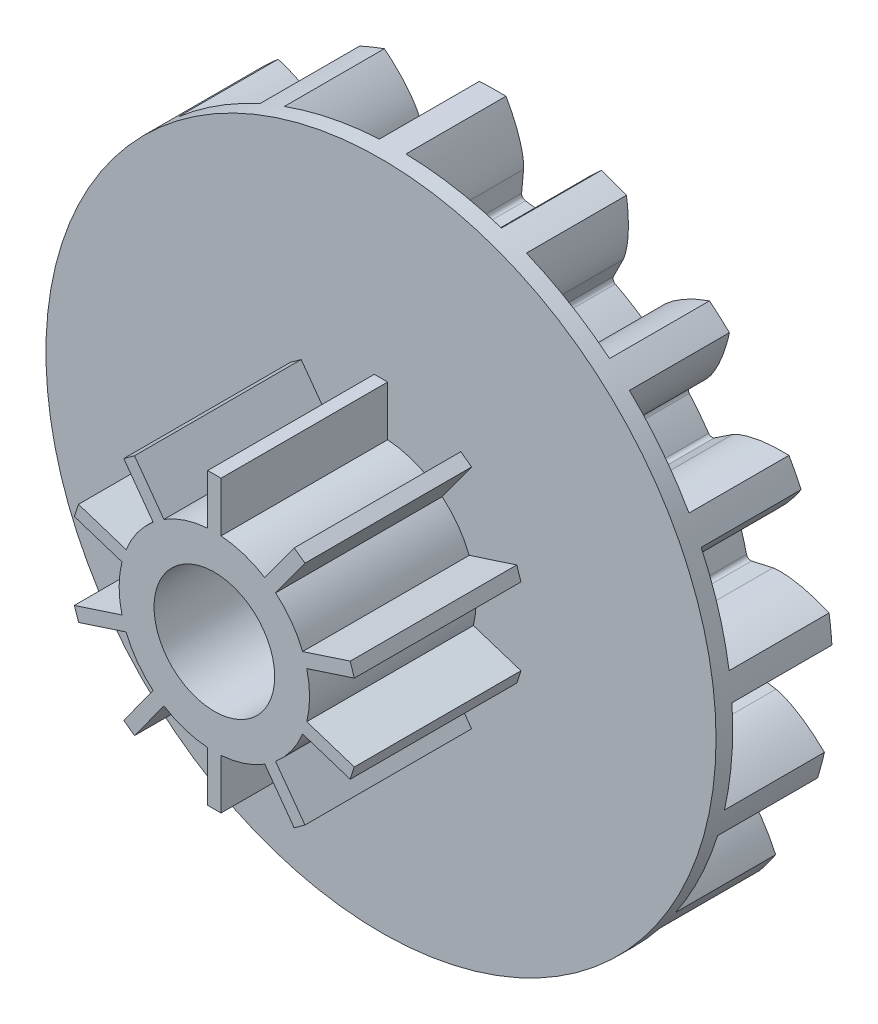
from build123d import *

# Parameters (mm, degrees)
SKETCH2_R                = 20.108333333
BOSS_EXTRUDE1_DEPTH      = 6
CUT_EXTRUDE1_DEPTH       = 6
FILLET1_R                = 0.254
CIRPATTERN3_COUNT        = 17
FILLET1_OF_CIRPATTERN3_R = 0.254
SKETCH3_R                = 20.108333333
BOSS_EXTRUDE2_DEPTH      = 1
SKETCH4_R                = 5.715
BOSS_EXTRUDE3_DEPTH      = 10
SKETCH5_R                = 3.6195
CUT_EXTRUDE2_DEPTH       = 34.13140731


# Read off the part's stored shape, not the designer's step: Cut-Extrude1
with BuildPart() as part:
    # Sketch2 → Boss-Extrude1 (new body)
    with BuildSketch(Plane.XY):
        Circle(SKETCH2_R)
    extrude(amount=BOSS_EXTRUDE1_DEPTH)

    # Cut-Extrude1 outline → Cut-Extrude1 (cut)
    with BuildSketch(Plane.XY):
        with BuildLine():
            add(Edge.make_bspline(
                [(19.612102582, -4.439651085), (19.59218272, -4.420144694), (19.481027528, -4.312057491), (19.281823842, -4.125802304), (19.027647422, -3.903870405), (18.736653642, -3.6720205), (18.488102998, -3.488372736), (18.278838062, -3.343732652), (18.06479967, -3.205862708), (17.846032667, -3.075867237), (17.622515491, -2.954551462), (17.412977477, -2.852505316), (17.218874021, -2.768479364), (17.051349157, -2.70513169), (16.919962398, -2.661842715), (16.815499428, -2.632987723), (16.750836023, -2.618045042), (16.716327791, -2.611824467), (16.703975724, -2.609894532)],
                knots=[0.535326435, 0.535326435, 0.535326435, 0.535326435, 0.535326435, 0.547323565, 0.602055884, 0.652783571, 0.680149903, 0.707515961, 0.734882063, 0.762248421, 0.789614741, 0.816980391, 0.844236067, 0.862480777, 0.880559096, 0.894007228, 0.903714168, 0.909090916, 0.909090916, 0.909090916, 0.909090916, 0.909090916], degree=4))
            ThreePointArc((19.612102582, -4.439651085), (20.047982875, -1.556744063), (20.062364768, 1.358892692))
            add(Edge.make_bspline(
                [(16.906636402, 0), (16.919138331, 0), (16.954193188, 0.000818937), (17.020388186, 0.005600345), (17.128053328, 0.017983396), (17.26454771, 0.040471157), (17.439843489, 0.077198498), (17.644591389, 0.13025328), (17.867370627, 0.198729599), (18.10693613, 0.284086584), (18.343148294, 0.378752509), (18.57590412, 0.481928477), (18.804988823, 0.592530314), (19.078909969, 0.735607669), (19.402206496, 0.919757374), (19.687595943, 1.099791494), (19.913164165, 1.253062757), (20.039672466, 1.342695175), (20.062364768, 1.358892692)],
                knots=[0, 0, 0, 0, 0, 0.005376748, 0.015083688, 0.02853182, 0.046610139, 0.064854849, 0.092110525, 0.119476175, 0.146842495, 0.174208853, 0.201574955, 0.228941013, 0.256307345, 0.307035032, 0.361767351, 0.373764481, 0.373764481, 0.373764481, 0.373764481, 0.373764481], degree=4))
            Line((16.906636402, 0), (15.345833333, 0))
            ThreePointArc((15.345833333, 0), (15.299776405, -1.188041522), (15.161882077, -2.368951786))
            Line((15.161882077, -2.368951786), (16.703975724, -2.609894532))
        make_face()
    cut_extrude1 = extrude(amount=CUT_EXTRUDE1_DEPTH, mode=Mode.SUBTRACT)

    # Fillet1
    fillet1_edges = [part.edges().sort_by_distance(p)[0] for p in [
        (15.161882077, -2.368951786, 3),
        (15.345833333, 0, 3),
    ]]
    fillet(fillet1_edges, radius=FILLET1_R)

    # CirPattern3: Cut-Extrude1 ×17 about axis
    cirpattern3_axis = Axis((0, 0, 55), (0, 0, -1))
    for i in range(1, CIRPATTERN3_COUNT):
        add(cut_extrude1.rotate(cirpattern3_axis, i * 360 / CIRPATTERN3_COUNT), mode=Mode.SUBTRACT)

    # Fillet1 of CirPattern3
    fillet1_of_cirpattern3_edges = [part.edges().sort_by_distance(p)[0] for p in [
        (13.282269892, -7.686085297, 3),
        (14.30956342, -5.543554402, 3),
        (9.608813559, -11.965170399, 3),
        (11.340707675, -10.338421065, 3),
        (4.63763371, -14.628292937, 3),
        (6.840226518, -13.737026675, 3),
        (-0.95988427, -15.315783456, 3),
        (1.415934866, -15.280370713, 3),
        (-6.42776456, -13.934792551, 3),
        (-4.199586635, -14.760016016, 3),
        (-11.027539628, -10.671830697, 3),
        (-9.247930691, -12.246239367, 3),
        (-14.137984364, -5.967578973, 3),
        (-13.047290462, -8.078540233, 3),
        (-15.339015971, -0.457372641, 3),
        (-15.084541359, -2.819789475, 3),
        (-14.468428474, 5.114604401, 3),
        (-15.084541359, 2.819789475, 3),
        (-11.643799539, 9.995825777, 3),
        (-13.047290462, 8.078540233, 3),
        (-7.246610956, 13.527055494, 3),
        (-9.247930691, 12.246239367, 3),
        (-1.870727409, 15.23138141, 3),
        (-4.199586635, 14.760016016, 3),
        (3.757808241, 14.878624866, 3),
        (1.415934866, 15.280370713, 3),
        (8.878831065, 12.516427589, 3),
        (6.840226518, 13.737026675, 3),
        (12.800718555, 8.46381741, 3),
        (11.340707675, 10.338421065, 3),
        (14.993798073, 3.268121791, 3),
        (14.30956342, 5.543554402, 3),
    ]]
    fillet(fillet1_of_cirpattern3_edges, radius=FILLET1_OF_CIRPATTERN3_R)

    # Sketch3 → Boss-Extrude2 (add)
    with BuildSketch(Plane.XY.offset(6)):
        with Locations(Location((0, 0, 0), (0, 0, 177.832995741))):
            Circle(SKETCH3_R)
    extrude(amount=BOSS_EXTRUDE2_DEPTH)

    # Sketch4 → Boss-Extrude3 (add)
    with BuildSketch(Plane.XY.offset(7)):
        Circle(SKETCH4_R)
        with BuildLine():
            ThreePointArc((-3.674561448, 4.377079296), (-3.359192717, 4.623532123), (-3.027347853, 4.847307498))
            Line((-3.027347853, 4.847307498), (-4.790703609, 7.274358481))
            Line((-4.790703609, 7.274358481), (-5.437917205, 6.804130279))
            Line((-5.437917205, 6.804130279), (-3.674561448, 4.377079296))
        make_face()
        with BuildLine():
            ThreePointArc((-5.545565317, 1.381278508), (-5.435287991, 1.766032123), (-5.298351721, 2.142123721))
            Line((-5.298351721, 2.142123721), (-8.15152127, 3.069174705))
            Line((-8.15152127, 3.069174705), (-8.398734866, 2.308329492))
            Line((-8.398734866, 2.308329492), (-5.545565317, 1.381278508))
        make_face()
        with BuildLine():
            Line((0.4, 8.700984564), (-0.4, 8.700984564))
            Line((-0.4, 8.700984564), (-0.4, 5.700984564))
            ThreePointArc((-0.4, 5.700984564), (0, 5.715), (0.4, 5.700984564))
            Line((0.4, 5.700984564), (0.4, 8.700984564))
        make_face()
        with BuildLine():
            Line((4.790703609, 7.274358481), (3.027347853, 4.847307498))
            ThreePointArc((3.027347853, 4.847307498), (3.359192717, 4.623532123), (3.674561448, 4.377079296))
            Line((3.674561448, 4.377079296), (5.437917205, 6.804130279))
            Line((5.437917205, 6.804130279), (4.790703609, 7.274358481))
        make_face()
        with BuildLine():
            Line((8.15152127, 3.069174705), (5.298351721, 2.142123721))
            ThreePointArc((5.298351721, 2.142123721), (5.435287991, 1.766032123), (5.545565317, 1.381278508))
            Line((5.545565317, 1.381278508), (8.398734866, 2.308329492))
            Line((8.398734866, 2.308329492), (8.15152127, 3.069174705))
        make_face()
        with BuildLine():
            Line((8.398734866, -2.308329492), (5.545565317, -1.381278508))
            ThreePointArc((5.545565317, -1.381278508), (5.435287991, -1.766032123), (5.298351721, -2.142123721))
            Line((5.298351721, -2.142123721), (8.15152127, -3.069174705))
            Line((8.15152127, -3.069174705), (8.398734866, -2.308329492))
        make_face()
        with BuildLine():
            Line((5.437917205, -6.804130279), (3.674561448, -4.377079296))
            ThreePointArc((3.674561448, -4.377079296), (3.359192717, -4.623532123), (3.027347853, -4.847307498))
            Line((3.027347853, -4.847307498), (4.790703609, -7.274358481))
            Line((4.790703609, -7.274358481), (5.437917205, -6.804130279))
        make_face()
        with BuildLine():
            ThreePointArc((0.4, -5.700984564), (0, -5.715), (-0.4, -5.700984564))
            Line((-0.4, -5.700984564), (-0.4, -8.700984564))
            Line((-0.4, -8.700984564), (0.4, -8.700984564))
            Line((0.4, -8.700984564), (0.4, -5.700984564))
        make_face()
        with BuildLine():
            ThreePointArc((-3.027347853, -4.847307498), (-3.359192717, -4.623532123), (-3.674561448, -4.377079296))
            Line((-3.674561448, -4.377079296), (-5.437917205, -6.804130279))
            Line((-5.437917205, -6.804130279), (-4.790703609, -7.274358481))
            Line((-4.790703609, -7.274358481), (-3.027347853, -4.847307498))
        make_face()
        with BuildLine():
            ThreePointArc((-5.298351721, -2.142123721), (-5.435287991, -1.766032123), (-5.545565317, -1.381278508))
            Line((-5.545565317, -1.381278508), (-8.398734866, -2.308329492))
            Line((-8.398734866, -2.308329492), (-8.15152127, -3.069174705))
            Line((-8.15152127, -3.069174705), (-5.298351721, -2.142123721))
        make_face()
    extrude(amount=BOSS_EXTRUDE3_DEPTH)

    # Sketch5 → Cut-Extrude2 (cut, through all)
    with BuildSketch(Plane.XY.offset(17)):
        Circle(SKETCH5_R)
    extrude(amount=-CUT_EXTRUDE2_DEPTH, mode=Mode.SUBTRACT)


solid = part.part
